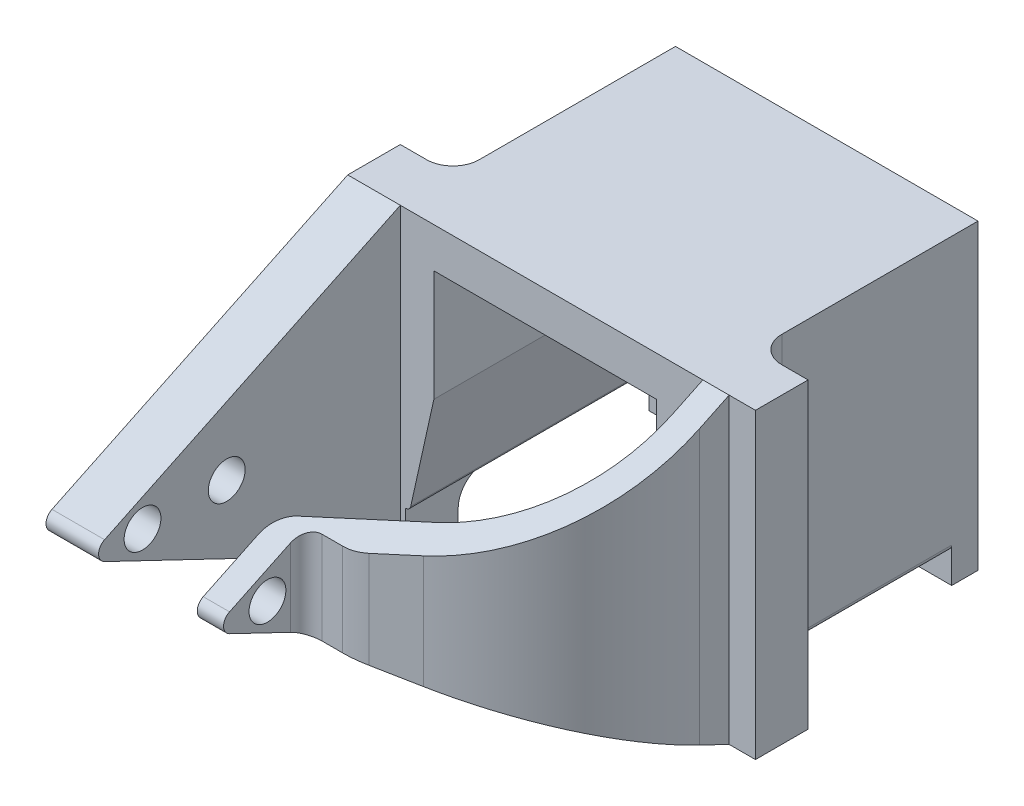
from build123d import *

# Parameters (mm, degrees)
SKETCH2_W           = 57.5
SKETCH2_H           = 57.5
BOSS_EXTRUDE1_DEPTH = 5
SKETCH3_W           = 57.5
SKETCH3_H           = 57.5
SKETCH3_W_2         = 42.3
SKETCH3_H_2         = 42.3
BOSS_EXTRUDE2_DEPTH = 47.3
SKETCH4_W           = 70
SKETCH4_H           = 57.5
BOSS_EXTRUDE3_DEPTH = 10
SKETCH5_W           = 70
SKETCH5_H           = 57.5
BOSS_EXTRUDE4_DEPTH = 10
SKETCH6_W           = 35
SKETCH6_H           = 57.5
BOSS_EXTRUDE5_DEPTH = 38.75
SKETCH7_R           = 3.5
CUT_EXTRUDE1_DEPTH  = 144.086652068
SKETCH8_R           = 3.5
CUT_EXTRUDE2_DEPTH  = 144.086652068
FILLET1_R           = 30
CUT_EXTRUDE3_DEPTH  = 144.066205582
CUT_EXTRUDE4_REACH  = 109.048
CUT_EXTRUDE5_DEPTH  = 149.047084333
FILLET4_R           = 2
FILLET5_R           = 30
FILLET6_R           = 5
SKETCH12_W          = 11
SKETCH12_H          = 10
BOSS_EXTRUDE6_DEPTH = 10
FILLET7_R           = 1
FILLET8_R           = 5
CUT_EXTRUDE6_DEPTH  = 142.014244348
FILLET10_R          = 3
FILLET11_R          = 10


with BuildPart() as part:
    # Sketch2 → Boss-Extrude1 (new body)
    with BuildSketch(Plane.XY):
        with Locations((28.75, 28.75)):
            Rectangle(SKETCH2_W, SKETCH2_H)
    extrude(amount=BOSS_EXTRUDE1_DEPTH)

    # Sketch3 → Boss-Extrude2 (add)
    with BuildSketch(Plane.XY.offset(5)):
        with Locations((28.75, 28.75)):
            Rectangle(SKETCH3_W, SKETCH3_H)
        with Locations((27.525892101, 28.75)):
            Rectangle(SKETCH3_W_2, SKETCH3_H_2, mode=Mode.SUBTRACT)
    extrude(amount=BOSS_EXTRUDE2_DEPTH)

    # Sketch4 → Boss-Extrude3 (add)
    with BuildSketch(Plane.ZY):
        with Locations((77.3, 28.75)):
            Rectangle(SKETCH4_W, SKETCH4_H)
    extrude(amount=BOSS_EXTRUDE3_DEPTH)

    # Sketch5 → Boss-Extrude4 (add)
    with BuildSketch(Plane(origin=(57.5, 0, 0), x_dir=(0, 0, -1), z_dir=(1, 0, 0))):
        with Locations((-77.3, 28.75)):
            Rectangle(SKETCH5_W, SKETCH5_H)
    extrude(amount=BOSS_EXTRUDE4_DEPTH)

    # Sketch6 → Boss-Extrude5 (add)
    with BuildSketch(Plane.ZY.offset(-57.5)):
        with Locations((94.8, 28.75)):
            Rectangle(SKETCH6_W, SKETCH6_H)
    extrude(amount=BOSS_EXTRUDE5_DEPTH)

    # Sketch7 → Cut-Extrude1 (cut, through all)
    with BuildSketch(Plane(origin=(0, 0, 0), x_dir=(0, 0, -1), z_dir=(1, 0, 0))):
        with Locations((-101.3, 28.75)):
            Circle(SKETCH7_R)
        with Locations((-85.3, 28.75)):
            Circle(SKETCH7_R)
    extrude(amount=-CUT_EXTRUDE1_DEPTH, mode=Mode.SUBTRACT)

    # Sketch8 → Cut-Extrude2 (cut, through all)
    with BuildSketch(Plane(origin=(0, 0, 0), x_dir=(0, 0, -1), z_dir=(1, 0, 0))):
        with Locations((-101.3, 28.75)):
            Circle(SKETCH8_R)
    extrude(amount=CUT_EXTRUDE2_DEPTH, mode=Mode.SUBTRACT)

    # Fillet1
    # the kernel refuses this fillet: 30 mm, written as the material it takes off along each edge
    with BuildSketch(Plane(origin=(75, 57.5, 112.3), x_dir=(0, -1, 0), z_dir=(-1, 0, 0)), Plane(origin=(75, 0, 112.3), x_dir=(0, 0, -1), z_dir=(-1, 0, 0))) as fillet1_piece_1:
        with BuildLine():
            CenterArc((FILLET1_R, -FILLET1_R), FILLET1_R, 90, 90)
            Line((0, -FILLET1_R), (0, 0))
            Line((0, 0), (FILLET1_R, 0))
        make_face()
    extrude(amount=160, mode=Mode.SUBTRACT)
    with BuildSketch(Plane(origin=(142.5, 57.5, 112.3), x_dir=(0, -1, 0), z_dir=(-1, 0, 0)), Plane(origin=(142.5, 0, 112.3), x_dir=(0, 0, -1), z_dir=(-1, 0, 0))) as fillet1_piece_2:
        with BuildLine():
            CenterArc((FILLET1_R, -FILLET1_R), FILLET1_R, 90, 90)
            Line((0, -FILLET1_R), (0, 0))
            Line((0, 0), (FILLET1_R, 0))
        make_face()
    extrude(amount=198.75, mode=Mode.SUBTRACT)

    # Sketch9 → Cut-Extrude3 (cut, through all)
    with BuildSketch(Plane.XZ):
        Polygon((18.75, 77.3), (18.75, 94.8), (57.5, 77.3), align=None)
    extrude(amount=-CUT_EXTRUDE3_DEPTH, mode=Mode.SUBTRACT)

    # Cut-Extrude4: up to this face of the body (flat: up to its plane)
    cut_extrude4_end = Plane(part.part.faces().sort_by_distance((27.525892101, 28.75, 5))[0])
    # Sketch10 → Cut-Extrude4 (cut, up to the picked face)
    with BuildSketch(Plane.XY.offset(52.3), mode=Mode.PRIVATE) as cut_extrude4_sk1:
        Polygon((6.375892101, 28.75), (0, 0), (57.5, 0), (48.675892101, 28.75), align=None)
    cut_extrude4_tool1 = split(extrude(cut_extrude4_sk1.sketch, amount=-CUT_EXTRUDE4_REACH, mode=Mode.PRIVATE), bisect_by=cut_extrude4_end, keep=Keep.BOTH, mode=Mode.PRIVATE)
    add(cut_extrude4_tool1.solids().sort_by(Axis((28.169019, 13.645207, 52.3), (0, 0, -1)))[0], mode=Mode.SUBTRACT)

    # Sketch11 → Cut-Extrude5 (cut, through all)
    with BuildSketch(Plane(origin=(67.5, 0, 0), x_dir=(0, 0, -1), z_dir=(1, 0, 0))):
        with BuildLine():
            ThreePointArc((-82.3, 57.5), (-103.066559657, 49.150635095), (-112.273947021, 28.75))
            Line((-112.273947021, 28.75), (-52.3, 57.5))
            Line((-52.3, 57.5), (-82.3, 57.5))
        make_face()
        with BuildLine():
            Line((-52.3, 0), (-112.273947021, 28.75))
            ThreePointArc((-112.273947021, 28.75), (-103.066559657, 8.349364905), (-82.3, 0))
            Line((-82.3, 0), (-52.3, 0))
        make_face()
    extrude(amount=-CUT_EXTRUDE5_DEPTH, mode=Mode.SUBTRACT)

    # Fillet4
    fillet4_edges = [part.edges().sort_by_distance(p)[0] for p in [
        (-5, 28.75, 112.273947021),
        (43.125, 28.75, 112.273947021),
    ]]
    fillet(fillet4_edges, radius=FILLET4_R)

    # Fillet5
    fillet5_edges = [part.edges().sort_by_distance(p)[0] for p in [
        (57.5, 28.75, 77.3),
    ]]
    fillet(fillet5_edges, radius=FILLET5_R)

    # Fillet6
    # the kernel refuses this fillet: 5 mm, written as the material it takes off along each edge
    with BuildSketch(Plane(origin=(18.75, 12.302985171, 94.8), x_dir=(0.9113705996586746, 0, -0.4115867224264991), z_dir=(0, 1, 0))) as fillet6_piece_1:
        with BuildLine():
            CenterArc((FILLET6_R * 0.645635571077, -FILLET6_R), FILLET6_R, 90, 65.695450734)
            Line((-FILLET6_R * 0.265735028582, -FILLET6_R * 0.588413277574), (0, 0))
            Line((0, 0), (FILLET6_R * 0.645635571077, 0))
        make_face()
    extrude(amount=32.894029659, mode=Mode.SUBTRACT)

    # Sketch12 → Boss-Extrude6 (add)
    with BuildSketch(Plane.XZ):
        with Locations((-4.5, 47.3)):
            Rectangle(SKETCH12_W, SKETCH12_H)
        with Locations((62, 47.3)):
            Rectangle(SKETCH12_W, SKETCH12_H)
    extrude(amount=-BOSS_EXTRUDE6_DEPTH)

    # Fillet7
    # the kernel refuses this fillet: 1 mm, written as the material it takes off along each edge
    with BuildSketch(Plane(origin=(57.5, 0, 5), x_dir=(-0.29341611276772167, 0.9559848245491555, 0), z_dir=(0, 0, 1))) as fillet7_piece_1_section:
        with BuildLine():
            CenterArc((FILLET7_R * 6.66624885082, -FILLET7_R), FILLET7_R, 90, 162.937415162)
            Line((FILLET7_R * 6.37283273805, -FILLET7_R * 1.95598482455), (0, 0))
            Line((0, 0), (FILLET7_R * 6.66624885082, 0))
        make_face()
    fillet7_piece_1 = extrude(amount=53.965622127, mode=Mode.PRIVATE)
    fillet7_piece_1 = split(fillet7_piece_1, bisect_by=Plane(origin=(56.5, 4.962220999, 23.65), z_dir=(-1, 0, 0)), keep=Keep.TOP, mode=Mode.PRIVATE)
    add(fillet7_piece_1, mode=Mode.SUBTRACT)
    with BuildSketch(Plane(origin=(57.5, 0, 5), x_dir=(-0.29341611276772167, 0.9559848245491555, 0), z_dir=(0, 0, 1))) as fillet7_piece_2:
        with BuildLine():
            CenterArc((FILLET7_R * 6.66624885082, -FILLET7_R), FILLET7_R, 90, 162.937415162)
            Line((FILLET7_R * 6.37283273805, -FILLET7_R * 1.95598482455), (0, 0))
            Line((0, 0), (FILLET7_R * 6.66624885082, 0))
        make_face()
    extrude(amount=37.3, mode=Mode.SUBTRACT)
    with BuildSketch(Plane(origin=(0, 0, 65.119750157), x_dir=(0, 1, 0), z_dir=(0, 0, -1))) as fillet7_piece_3_section:
        with BuildLine():
            CenterArc((FILLET7_R * 9.12790006293, FILLET7_R), FILLET7_R, 102.504122974, 167.495877026)
            Line((FILLET7_R * 8.91139019581, FILLET7_R * 1.97628042971), (0, 0))
            Line((0, 0), (FILLET7_R * 9.12790006293, 0))
        make_face()
    fillet7_piece_3 = extrude(amount=60.119750157, mode=Mode.PRIVATE)
    fillet7_piece_3 = split(fillet7_piece_3, bisect_by=Plane(origin=(1, 7.031734734, 47.3), z_dir=(1, 0, 0)), keep=Keep.TOP, mode=Mode.PRIVATE)
    add(fillet7_piece_3, mode=Mode.SUBTRACT)
    with BuildSketch(Plane(origin=(0, 0, 42.3), x_dir=(0, 1, 0), z_dir=(0, 0, -1))) as fillet7_piece_4:
        with BuildLine():
            CenterArc((FILLET7_R * 9.12790006293, FILLET7_R), FILLET7_R, 102.504122974, 167.495877026)
            Line((FILLET7_R * 8.91139019581, FILLET7_R * 1.97628042971), (0, 0))
            Line((0, 0), (FILLET7_R * 9.12790006293, 0))
        make_face()
    extrude(amount=37.3, mode=Mode.SUBTRACT)

    # Fillet8
    fillet8_edges = [part.edges().sort_by_distance(p)[0] for p in [
        (0.292893219, 8.420793282, 42.3),
        (57.207106781, 5.95914207, 42.3),
        (0, 33.313950031, 42.3),
        (57.5, 32.083124425, 42.3),
    ]]
    fillet(fillet8_edges, radius=FILLET8_R)

    # Sketch13 → Cut-Extrude6 (cut, through all)
    with BuildSketch(Plane.XZ):
        with BuildLine():
            Line((32.827767642, 93.928540856), (23.75, 93.928540856))
            Line((23.75, 93.928540856), (23.75, 98.028177855))
            Line((23.75, 98.028177855), (23.75, 108.511784994))
            Line((23.75, 108.511784994), (23.75, 111.823529661))
            Line((23.75, 111.823529661), (71.506891102, 111.823529661))
            Line((71.506891102, 111.823529661), (71.506891102, 52.3))
            Line((71.506891102, 52.3), (62.5, 52.3))
            Line((62.5, 52.3), (62.5, 57.930932868))
            ThreePointArc((62.5, 57.930932868), (56.904028083, 76.915219331), (41.905535285, 89.828903856))
            Line((41.905535285, 89.828903856), (32.827767642, 93.928540856))
        make_face()
    extrude(amount=-CUT_EXTRUDE6_DEPTH, mode=Mode.SUBTRACT)

    # Fillet10
    fillet10_edges = [part.edges().sort_by_distance(p)[0] for p in [
        (23.75, 28.75, 93.928540856),
    ]]
    fillet(fillet10_edges, radius=FILLET10_R)

    # Fillet11
    fillet11_edges = [part.edges().sort_by_distance(p)[0] for p in [
        (32.827767642, 28.75, 93.928540856),
    ]]
    fillet(fillet11_edges, radius=FILLET11_R)


solid = part.part
